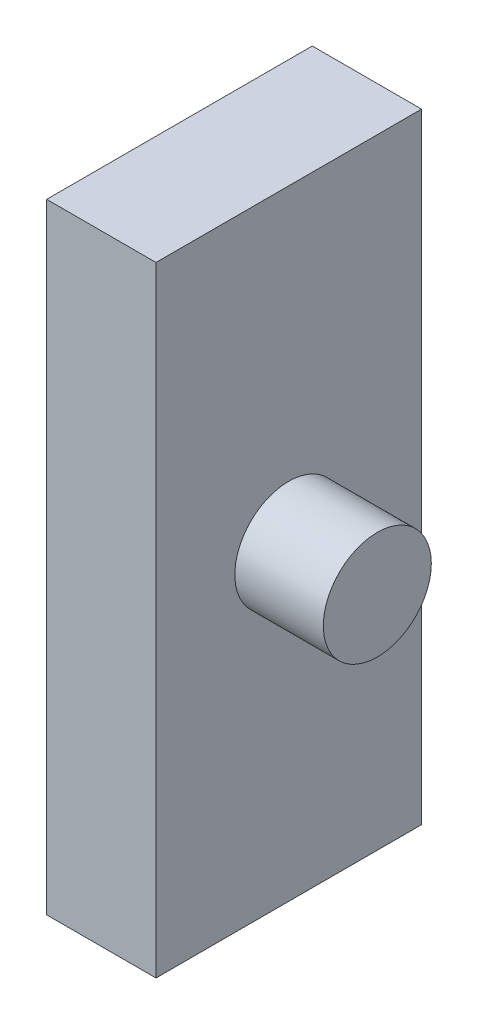
from build123d import *

# Parameters (mm, degrees)
SKETCH1_W           = 15
SKETCH1_H           = 35
SKETCH1_W_2         = 3.275
SKETCH1_H_2         = 13
BOSS_EXTRUDE1_DEPTH = 4.175
SKETCH2_W           = 15
SKETCH2_H           = 35
BOSS_EXTRUDE2_DEPTH = 2
SKETCH3_R           = 3.05
BOSS_EXTRUDE3_DEPTH = 5


with BuildPart() as part:
    # Sketch1 → Boss-Extrude1 (new body)
    with BuildSketch(Plane(origin=(0, 0, 0), x_dir=(0, 0, -1), z_dir=(1, 0, 0))):
        with Locations((7.5, 17.5)):
            Rectangle(SKETCH1_W, SKETCH1_H)
        with Locations((7.5, 17.5)):
            Rectangle(SKETCH1_W_2, SKETCH1_H_2, mode=Mode.SUBTRACT)
    extrude(amount=BOSS_EXTRUDE1_DEPTH)

    # Sketch2 → Boss-Extrude2 (add)
    with BuildSketch(Plane(origin=(4.175, 0, 0), x_dir=(0, 0, -1), z_dir=(1, 0, 0))):
        with Locations((7.5, 17.5)):
            Rectangle(SKETCH2_W, SKETCH2_H)
    extrude(amount=BOSS_EXTRUDE2_DEPTH)

    # Sketch3 → Boss-Extrude3 (add)
    with BuildSketch(Plane(origin=(6.175, 0, 0), x_dir=(0, 0, -1), z_dir=(1, 0, 0))):
        with Locations((7.5, 17.5)):
            Circle(SKETCH3_R)
    extrude(amount=BOSS_EXTRUDE3_DEPTH)


solid = part.part
